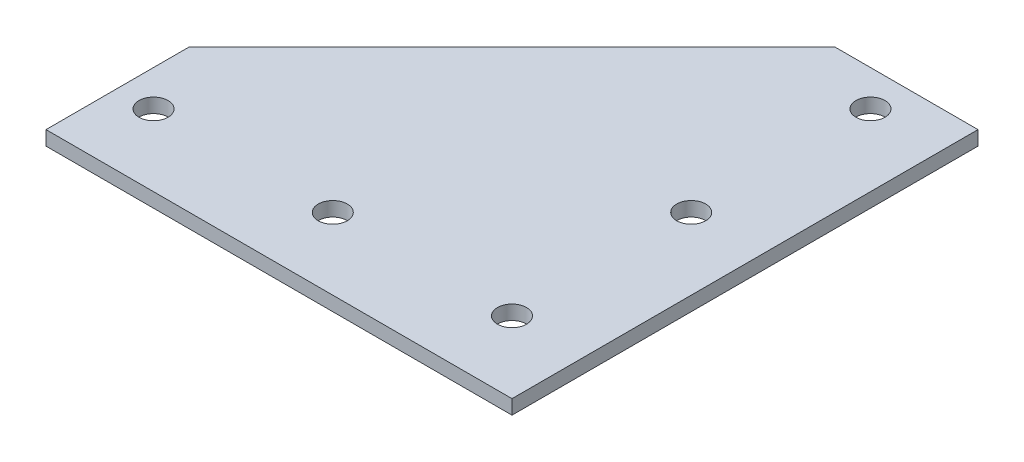
from build123d import *

# Parameters (mm, degrees)
SKETCH1_R           = 4.05
BOSS_EXTRUDE1_DEPTH = 4


with BuildPart() as part:
    # Sketch1 → Boss-Extrude1 (new body)
    with BuildSketch(Plane(origin=(0, 0, 0), x_dir=(1, 0, 0), z_dir=(0, 1, 0))):
        Polygon((20, -20), (-110, -20), (-110, 20), (-20, 110), (20, 110), align=None)
        with Locations((-100, 0)):
            Circle(SKETCH1_R, mode=Mode.SUBTRACT)
        with Locations((-50, 0)):
            Circle(SKETCH1_R, mode=Mode.SUBTRACT)
        Circle(SKETCH1_R, mode=Mode.SUBTRACT)
        with Locations((0, 100)):
            Circle(SKETCH1_R, mode=Mode.SUBTRACT)
        with Locations((0, 50)):
            Circle(SKETCH1_R, mode=Mode.SUBTRACT)
    extrude(amount=BOSS_EXTRUDE1_DEPTH)


solid = part.part
